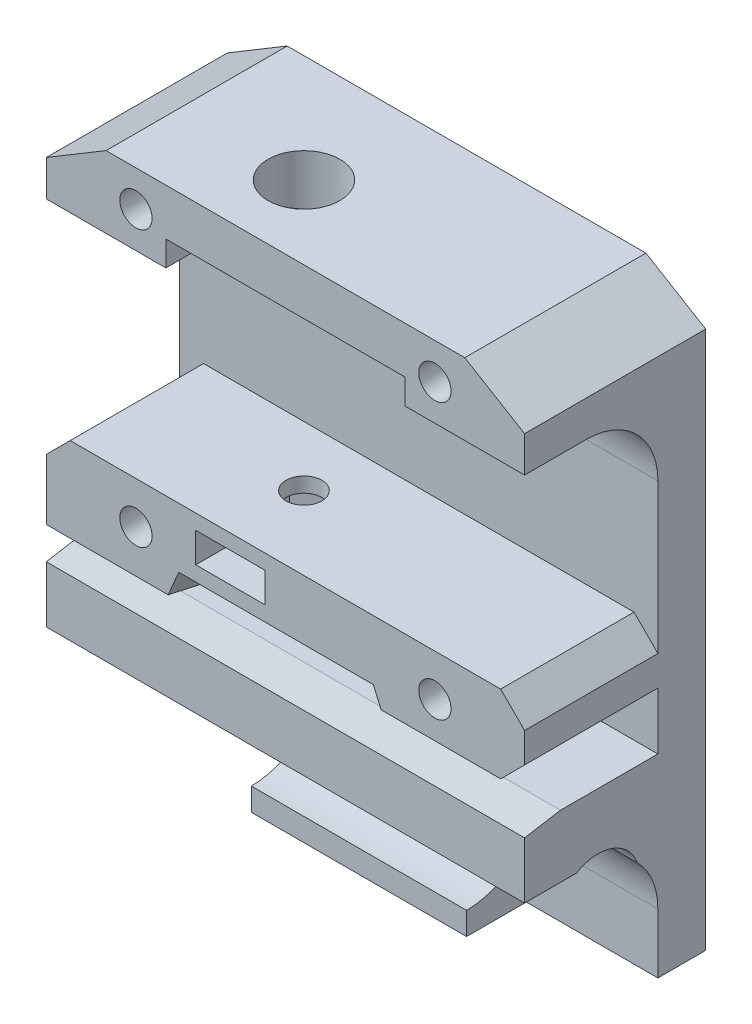
from build123d import *

# Parameters (mm, degrees)
SKETCH1_W                = 40
SKETCH1_H                = 48
BOSS_EXTRUDE1_DEPTH      = 4
BOSS_EXTRUDE2_DEPTH      = 11.15
BOSS_EXTRUDE2_DEPTH_BACK = 4
SKETCH5_W                = 40
SKETCH5_H                = 5.225
SKETCH5_W_2              = 18
SKETCH5_H_2              = 5
SKETCH5_H_3              = 6
FILLET1_DEPTH            = 40
SKETCH6_R                = 1.35
CUT_EXTRUDE4_DEPTH       = 58.214705278
CHAMFER2_SIZE            = 2
CHAMFER3_SIZE            = 3
CHAMFER3_SIZE2           = 1
CHAMFER4_SIZE            = 3
CHAMFER4_SIZE2           = 0.5
CUT_EXTRUDE6_DEPTH       = 10
CUT_EXTRUDE6_DEPTH_BACK  = 10
CUT_EXTRUDE8_REACH       = 66.292
SKETCH12_R               = 3
SKETCH13_R               = 1.5
CUT_EXTRUDE10_DEPTH      = 10.275
CUT_EXTRUDE7_DEPTH       = 1.25
CUT_EXTRUDE7_DEPTH_BACK  = 1.25
CHAMFER5_SIZE            = 5
CHAMFER5_SIZE2           = 3
CHAMFER6_SIZE            = 3
CHAMFER6_SIZE2           = 5
CUT_EXTRUDE12_DEPTH      = 46.535947422
CUT_EXTRUDE12_DEPTH_BACK = 46.535947422
SKETCH15_R               = 3.5


with BuildPart() as part:
    # Sketch1 → Boss-Extrude1 (new body)
    with BuildSketch(Plane.XY):
        with Locations((20, 14)):
            Rectangle(SKETCH1_W, SKETCH1_H)
    extrude(amount=BOSS_EXTRUDE1_DEPTH)

    # Sketch5 → Boss-Extrude2 (add, two sides: drawn at the far end of the back side and taken through both)
    with BuildSketch(Plane.XY.offset(4).offset(-BOSS_EXTRUDE2_DEPTH_BACK)):
        Polygon((0.9, 8.125), (0, 8.125), (0, 15.5), (40, 15.5), (40, 9), (28, 9), (27.357142857, 10.5), (11.081237185, 10.5), (9.763380042, 7.425), (8.800403155, 7.425), (8.500403155, 8.125), (7.531690021, 8.125), (7.231690021, 7.425), (6.221941609, 7.425), (5.921941609, 8.125), (5, 8.125), (4.7, 7.425), (3.7, 7.425), (3.4, 8.125), (2.5, 8.125), (2.2, 7.425), (1.2, 7.425), align=None)
        with Locations((20, 3.6125)):
            Rectangle(SKETCH5_W, SKETCH5_H)
        with Locations((20, -7.5)):
            Rectangle(SKETCH5_W_2, SKETCH5_H_2)
        with Locations((20, 35)):
            Rectangle(SKETCH5_W, SKETCH5_H_3)
    extrude(amount=BOSS_EXTRUDE2_DEPTH + BOSS_EXTRUDE2_DEPTH_BACK)

    # Fillet1: read off the stored shape, not the designer's step
    # Fillet1 outline → Fillet1 (add)
    with BuildSketch(Plane.YZ):
        with BuildLine():
            Line((32, 4), (32, 10))
            ThreePointArc((32, 10), (30.242640687, 5.757359313), (26, 4))
            Line((26, 4), (32, 4))
        make_face()
        with BuildLine():
            Line((1, 4), (1, 10))
            ThreePointArc((1, 10), (-0.757359313, 5.757359313), (-5, 4))
            Line((-5, 4), (1, 4))
        make_face()
    extrude(amount=FILLET1_DEPTH)

    # Sketch6 → Cut-Extrude4 (cut, through all)
    with BuildSketch(Plane.XY.offset(15.15)):
        with Locations((7.5, 35)):
            Circle(SKETCH6_R)
        with Locations((7.5, 12)):
            Circle(SKETCH6_R)
        with Locations((32.5, 35)):
            Circle(SKETCH6_R)
        with Locations((32.5, 12)):
            Circle(SKETCH6_R)
    extrude(amount=-CUT_EXTRUDE4_DEPTH, mode=Mode.SUBTRACT)

    # Chamfer2
    chamfer2_edges = [part.edges().sort_by_distance(p)[0] for p in [
        (40, 9, 9.575),
        (0, 15.5, 9.575),
        (40, 15.5, 9.575),
    ]]
    chamfer(chamfer2_edges, length=CHAMFER2_SIZE)

    # Chamfer3
    chamfer3_edges = [part.edges().sort_by_distance(p)[0] for p in [
        (4.2, 7.425, 15.15),
    ]]
    chamfer3_side = [part.faces().sort_by_distance(p)[0] for p in [
        (4.2, 7.425, 9.575),
    ]]
    chamfer(chamfer3_edges, length=CHAMFER3_SIZE, length2=CHAMFER3_SIZE2, reference=chamfer3_side[0])

    # Chamfer4
    chamfer4_edges = [part.edges().sort_by_distance(p)[0] for p in [
        (20, 6.225, 15.15),
    ]]
    chamfer4_side = [part.faces().sort_by_distance(p)[0] for p in [
        (20, 6.225, 9.575),
    ]]
    chamfer(chamfer4_edges, length=CHAMFER4_SIZE, length2=CHAMFER4_SIZE2, reference=chamfer4_side[0])

    # Sketch8 → Cut-Extrude6 (cut, two sides: drawn at the far end of the back side and taken through both)
    with BuildSketch(Plane(origin=(20, 0, 0), x_dir=(0, 0, -1), z_dir=(1, 0, 0)).offset(-CUT_EXTRUDE6_DEPTH_BACK)):
        with BuildLine():
            Line((-9, 34.1), (-18.820916768, 34.1))
            Line((-18.820916768, 34.1), (-18.820916768, 21.9))
            Line((-18.820916768, 21.9), (-9, 21.9))
            ThreePointArc((-9, 21.9), (-2.9, 28), (-9, 34.1))
        make_face()
        with BuildLine():
            Line((-18.820916768, -10.472551988), (-18.820916768, -3.194214037))
            Line((-18.820916768, -3.194214037), (-13.313351365, 2.313351365))
            ThreePointArc((-13.313351365, 2.313351365), (-3.364334852, 0.334368937), (-9, -8.1))
            Line((-9, -8.1), (-9, -10.472551988))
            Line((-9, -10.472551988), (-18.820916768, -10.472551988))
        make_face()
    extrude(amount=CUT_EXTRUDE6_DEPTH + CUT_EXTRUDE6_DEPTH_BACK, mode=Mode.SUBTRACT)

    # Cut-Extrude8: up to this face of the body (flat: up to its plane)
    cut_extrude8_end = Plane(part.part.faces().sort_by_distance((20, 15.5, 9.575))[0])
    # Sketch12 → Cut-Extrude8 (cut, up to the picked face)
    with BuildSketch(Plane(origin=(0, 38, 0), x_dir=(1, 0, 0), z_dir=(0, 1, 0)), mode=Mode.PRIVATE) as cut_extrude8_sk1:
        with Locations(Location((15.4, -9, 0), (0, 0, 270))):
            Circle(SKETCH12_R)
    cut_extrude8_tool1 = split(extrude(cut_extrude8_sk1.sketch, amount=-CUT_EXTRUDE8_REACH, mode=Mode.PRIVATE), bisect_by=cut_extrude8_end, keep=Keep.BOTH, mode=Mode.PRIVATE)
    add(cut_extrude8_tool1.solids().sort_by(Axis((15.4, 38, 9), (0, -1, 0)))[0], mode=Mode.SUBTRACT)

    # Sketch13 → Cut-Extrude10 (cut)
    with BuildSketch(Plane(origin=(0, 15.5, 0), x_dir=(1, 0, 0), z_dir=(0, 1, 0))):
        with Locations(Location((15.4, -9, 0), (0, 0, 180))):
            Circle(SKETCH13_R)
    extrude(amount=-CUT_EXTRUDE10_DEPTH, mode=Mode.SUBTRACT)

    # Sketch9 → Cut-Extrude7 (cut, two sides: drawn at the far end of the back side and taken through both)
    with BuildSketch(Plane.XZ.offset(-13).offset(-CUT_EXTRUDE7_DEPTH_BACK)):
        Polygon((12.5, 16.815347994), (18.3, 16.815347994), (18.3, 7.325684219), (15.4, 5.651368439), (12.5, 7.325684219), align=None)
    extrude(amount=CUT_EXTRUDE7_DEPTH + CUT_EXTRUDE7_DEPTH_BACK, mode=Mode.SUBTRACT)

    # Chamfer5
    chamfer5_edges = [part.edges().sort_by_distance(p)[0] for p in [
        (0, 38, 7.575),
    ]]
    chamfer5_side = [part.faces().sort_by_distance(p)[0] for p in [
        (20.225127502, 38, 7.505259415),
    ]]
    chamfer(chamfer5_edges, length=CHAMFER5_SIZE, length2=CHAMFER5_SIZE2, reference=chamfer5_side[0])

    # Chamfer6
    chamfer6_edges = [part.edges().sort_by_distance(p)[0] for p in [
        (40, 38, 7.575),
    ]]
    chamfer6_side = [part.faces().sort_by_distance(p)[0] for p in [
        (40, 5.721658913, 8.075),
    ]]
    chamfer(chamfer6_edges, length=CHAMFER6_SIZE, length2=CHAMFER6_SIZE2, reference=chamfer6_side[0])

    # Sketch15 → Cut-Extrude12 (cut, two sides: drawn at the far end of the back side and taken through both)
    with BuildSketch(Plane(origin=(20, 0, 0), x_dir=(0, 0, -1), z_dir=(1, 0, 0)).offset(-CUT_EXTRUDE12_DEPTH_BACK)):
        with Locations((-9, -2)):
            Circle(SKETCH15_R)
    extrude(amount=CUT_EXTRUDE12_DEPTH + CUT_EXTRUDE12_DEPTH_BACK, mode=Mode.SUBTRACT)


solid = part.part
